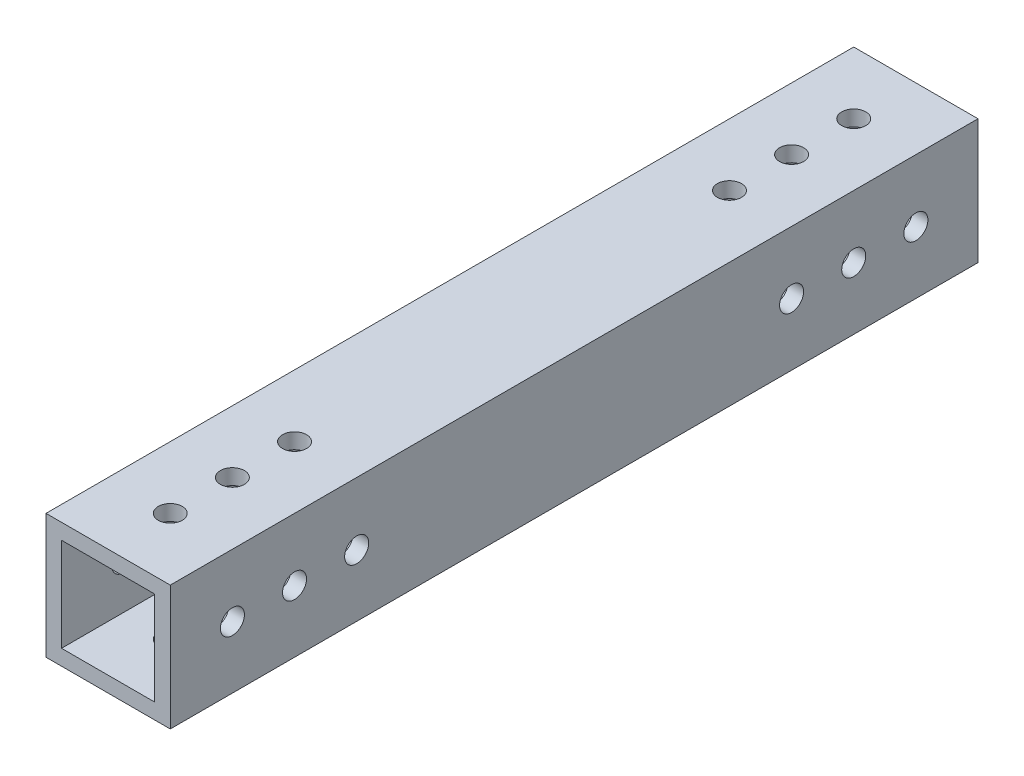
from build123d import *

# Parameters (mm, degrees)
SKETCH1_W                    = 25.4
SKETCH1_H                    = 25.475595238
SKETCH1_W_2                  = 19.05
SKETCH1_H_2                  = 19.125595238
EXTRUDE_THIN1_DEPTH          = 165.1
F_10_0_1935_DIAMETER_HOLE1_D = 4.9149
F_10_0_1935_DIAMETER_HOLE2_D = 4.9149


with BuildPart() as part:
    # Sketch1 → Extrude-Thin1 (new body)
    with BuildSketch(Plane.XY):
        with Locations((-12.7, 12.737797619)):
            Rectangle(SKETCH1_W, SKETCH1_H)
        with Locations((-12.7, 12.737797619)):
            Rectangle(SKETCH1_W_2, SKETCH1_H_2, mode=Mode.SUBTRACT)
    extrude(amount=EXTRUDE_THIN1_DEPTH)

    # #10 (0.1935) Diameter Hole1 (through all)
    with Locations(Plane(origin=(0, 0, 0), x_dir=(-1, 0, 0), z_dir=(0, -1, 0))):
        with Locations((12.7, -25.4), (12.7, -12.7), (12.7, -38.1), (12.7, -127), (12.7, -139.7), (12.7, -152.4)):
            Hole(F_10_0_1935_DIAMETER_HOLE1_D / 2)

    # #10 (0.1935) Diameter Hole2 (through all)
    with Locations(Plane.ZY.offset(25.4)):
        with Locations((152.4, 12.666654514), (139.7, 12.666654514), (127, 12.666654514), (38.1, 12.7), (25.4, 12.7), (12.7, 12.7)):
            Hole(F_10_0_1935_DIAMETER_HOLE2_D / 2)


solid = part.part
